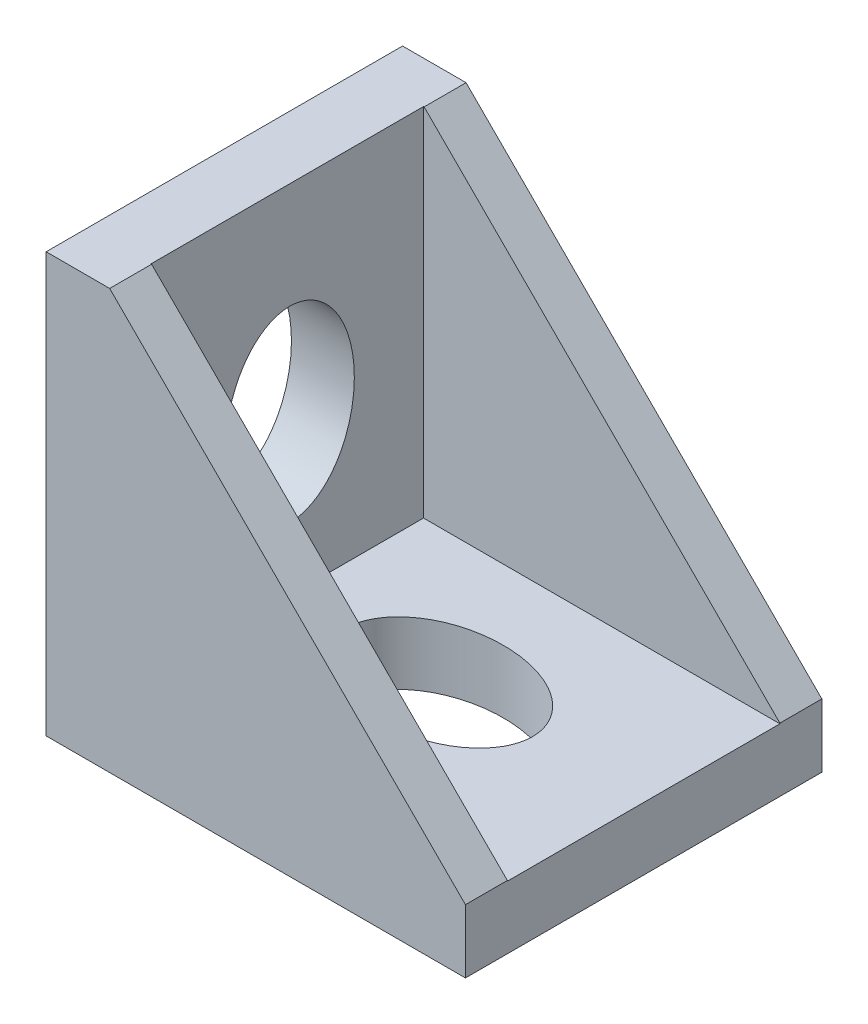
from build123d import *

# Parameters (mm, degrees)
BOSS_EXTRUDE1_DEPTH = 17
SKETCH2_W           = 17
SKETCH2_H           = 17
CUT_EXTRUDE1_DEPTH  = 13
SKETCH3_RX          = 4.47
SKETCH3_RY          = 3.075
CUT_EXTRUDE2_DEPTH  = 13
SKETCH5_RX          = 4.47
SKETCH5_RY          = 3.075
CUT_EXTRUDE3_DEPTH  = 13
SKETCH6_W           = 3.5
SKETCH6_H           = 1.5
BOSS_EXTRUDE2_DEPTH = 1
FILLET1_R           = 0.75
SKETCH7_W           = 1.5
SKETCH7_H           = 3.5
BOSS_EXTRUDE3_DEPTH = 1
FILLET2_R           = 0.75


with BuildPart() as part:
    # Sketch1 → Boss-Extrude1 (new body)
    with BuildSketch(Plane.XY):
        Polygon((0, 0), (0, 20), (3.029437252, 20), (20, 3.029437252), (20, 0), align=None)
    extrude(amount=BOSS_EXTRUDE1_DEPTH)

    # Sketch2 → Cut-Extrude1 (cut)
    with BuildSketch(Plane.XY.offset(2)):
        with Locations((11.5, 11.5)):
            Rectangle(SKETCH2_W, SKETCH2_H)
    extrude(amount=CUT_EXTRUDE1_DEPTH, mode=Mode.SUBTRACT)

    # Sketch3 → Cut-Extrude2 (cut)
    with BuildSketch(Plane(origin=(0, 0, 0), x_dir=(1, 0, 0), z_dir=(0, 1, 0))):
        with Locations((10.16, -8.425)):
            Ellipse(SKETCH3_RX, SKETCH3_RY)
    extrude(amount=CUT_EXTRUDE2_DEPTH, mode=Mode.SUBTRACT)

    # Sketch5 → Cut-Extrude3 (cut)
    with BuildSketch(Plane(origin=(0, 0, 0), x_dir=(0, 0, -1), z_dir=(1, 0, 0))):
        with Locations(Location((-8.375, 10.47), (0, 0, 90))):
            Ellipse(SKETCH5_RX, SKETCH5_RY)
    extrude(amount=CUT_EXTRUDE3_DEPTH, mode=Mode.SUBTRACT)

    # Sketch6 → Boss-Extrude2 (add)
    with BuildSketch(Plane(origin=(0, 0, 0), x_dir=(0, 0, -1), z_dir=(1, 0, 0))):
        with Locations((-8.25, 18.25)):
            Rectangle(SKETCH6_W, SKETCH6_H)
        with Locations((-8.25, 2.75)):
            Rectangle(SKETCH6_W, SKETCH6_H)
    extrude(amount=-BOSS_EXTRUDE2_DEPTH)

    # Fillet1
    fillet1_edges = [part.edges().sort_by_distance(p)[0] for p in [
        (-0.5, 2, 6.5),
        (-0.5, 17.5, 6.5),
        (-0.5, 2, 10),
        (-0.5, 3.5, 10),
        (-0.5, 3.5, 6.5),
        (-0.5, 17.5, 10),
        (-0.5, 19, 10),
        (-0.5, 19, 6.5),
    ]]
    fillet(fillet1_edges, radius=FILLET1_R - 0.0001)  # a hair under: the kernel refuses the full size

    # Sketch7 → Boss-Extrude3 (add)
    with BuildSketch(Plane(origin=(0, 0, 0), x_dir=(1, 0, 0), z_dir=(0, 1, 0))):
        with Locations((2.75, -8.25)):
            Rectangle(SKETCH7_W, SKETCH7_H)
        with Locations((18.25, -8.25)):
            Rectangle(SKETCH7_W, SKETCH7_H)
    extrude(amount=-BOSS_EXTRUDE3_DEPTH)

    # Fillet2
    fillet2_edges = [part.edges().sort_by_distance(p)[0] for p in [
        (3.5, -0.5, 6.5),
        (2, -0.5, 6.5),
        (2, -0.5, 10),
        (3.5, -0.5, 10),
        (17.5, -0.5, 10),
        (19, -0.5, 10),
        (17.5, -0.5, 6.5),
        (19, -0.5, 6.5),
    ]]
    fillet(fillet2_edges, radius=FILLET2_R - 0.0001)  # a hair under: the kernel refuses the full size


solid = part.part
